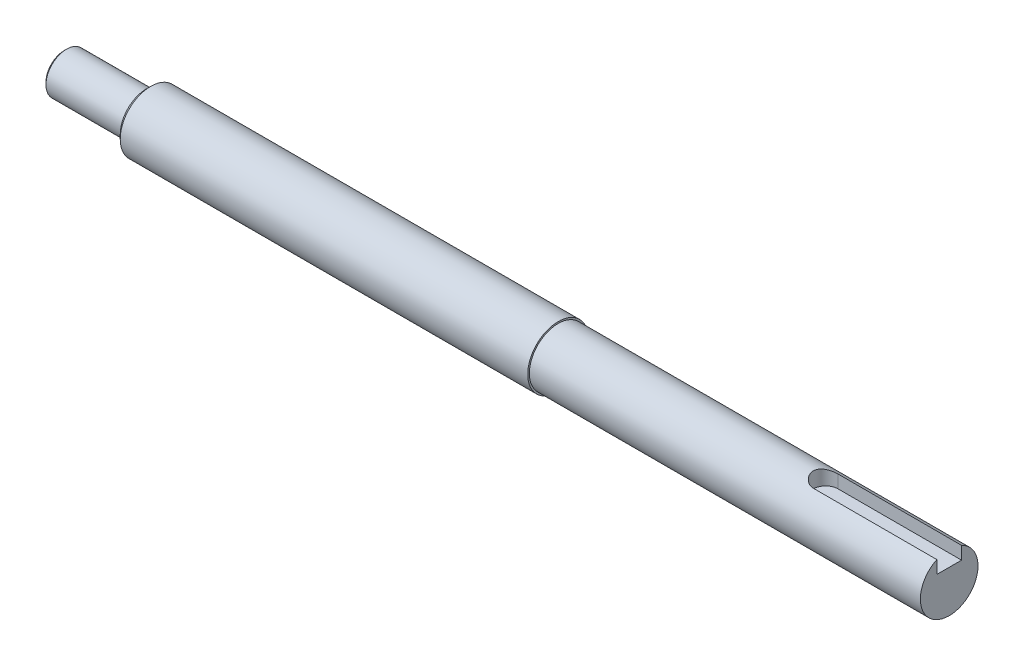
from build123d import *

# Parameters (mm, degrees)
CHAMFER1_SIZE      = 1
CUT_EXTRUDE1_START = 3.2
CUT_EXTRUDE1_DEPTH = 10


# Read off the part's stored shape, not the designer's step: M10x1.0 Machine Threads Stud1
with BuildPart() as part:
    # Sketch1 → Revolve1 (revolve)
    with BuildSketch(Plane(origin=(0, 0, 0), x_dir=(1, 0, 0), z_dir=(0, 1, 0))):
        Polygon((0, 0), (0, 7), (20, 7), (20, 7.4), (120, 7.4), (120, 7), (215, 7), (215, 0), align=None)
    revolve(axis=Axis((215, 0, 0), (-1, 0, 0)))

    # M10x1.0 Machine Threads Stud1 outline → M10x1.0 Machine Threads Stud1 (revolve, cut)
    with BuildSketch(Plane.YX):
        Polygon((7, 20), (5, 20), (5, 0.5545), (4.4455, 0), (7, 0), align=None)
    revolve(axis=Axis((0, 0, 0), (1, 0, 0)), mode=Mode.SUBTRACT)

    # Chamfer1
    chamfer1_edges = [part.edges().sort_by_distance(p)[0] for p in [
        (20, 0, 7.4),
    ]]
    chamfer(chamfer1_edges, length=CHAMFER1_SIZE)

    # Sketch3 → Cut-Extrude1 (cut)
    with BuildSketch(Plane(origin=(0, 0, 0), x_dir=(1, 0, 0), z_dir=(0, 1, 0)).offset(CUT_EXTRUDE1_START)):
        with BuildLine():
            Line((245, -3), (185, -3))
            ThreePointArc((185, -3), (182, 0), (185, 3))
            Line((185, 3), (245, 3))
            Line((245, 3), (245, -3))
        make_face()
    extrude(amount=CUT_EXTRUDE1_DEPTH, mode=Mode.SUBTRACT)


solid = part.part
